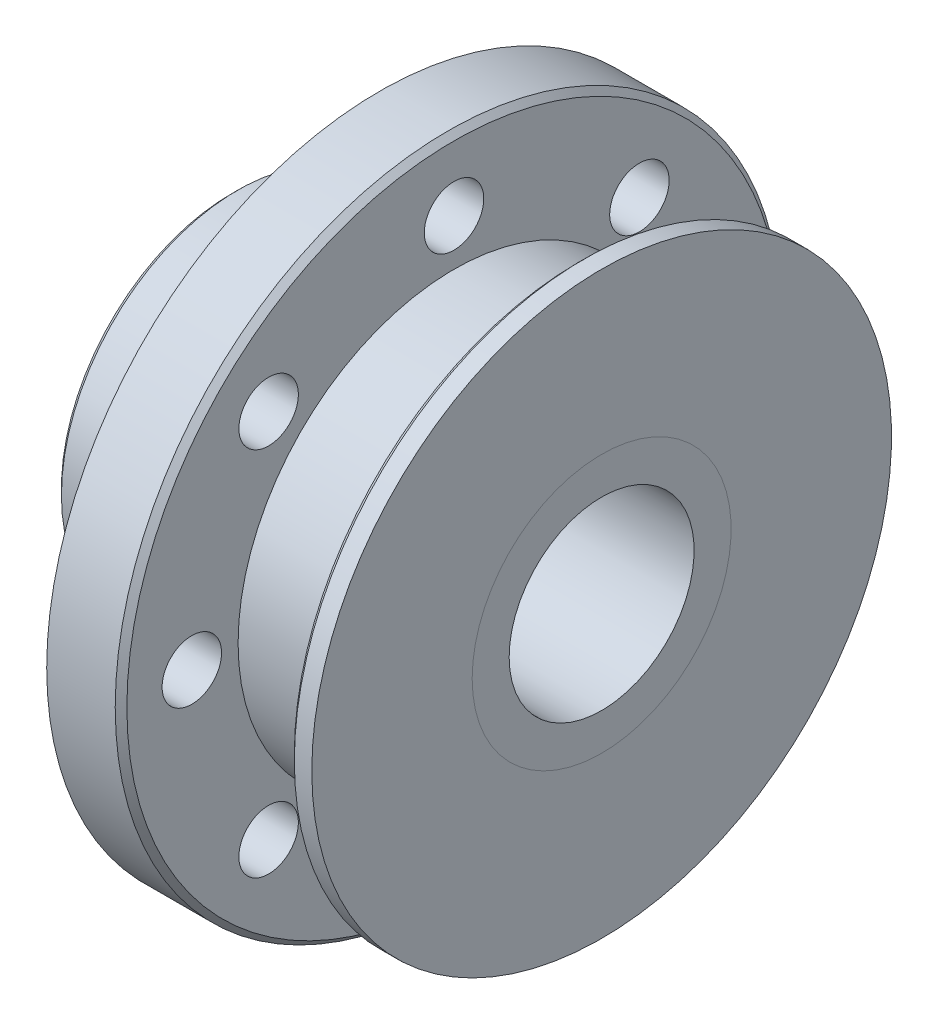
from build123d import *

# Parameters (mm, degrees)
F_1_4_20_TAPPED_HOLE1_D     = 5.1054
F_1_4_20_TAPPED_HOLE1_DEPTH = 10.16
F_1_4_20_TAPPED_HOLE1_TIP   = 1.533816902
SKETCH5_W                   = 12.7
SKETCH5_H                   = 3.175
CHAMFER1_SIZE               = 0.5


with BuildPart() as part:
    # Sketch1 → Revolve1 (revolve)
    with BuildSketch(Plane.XY):
        Polygon((-12.7, 15.112500017), (0, 15.112500017), (0, 28.575), (6.37999994, 28.575), (6.37999994, 24.875000034), (6.37999994, 18.52951598), (17.04999994, 18.52951598), (17.04999994, 24.875000034), (19.05, 24.875000034), (19.05, 11.1125), (6.35, 11.1125), (6.35, 8.9375), (0, 8.9375), (0, 11.1125), (-12.7, 11.1125), align=None)
    revolve(axis=Axis((0, 0, 0), (1, 0, 0)))

    # 1/4-20 Tapped Hole1
    with Locations(Plane.ZY):
        with Locations((-15.909902577, -15.909902577), (-22.5, 0), (-15.909902577, 15.909902577), (0, 22.5), (15.909902577, 15.909902577), (22.5, 0), (15.909902577, -15.909902577), (0, -22.5)):
            Hole(F_1_4_20_TAPPED_HOLE1_D / 2, depth=F_1_4_20_TAPPED_HOLE1_DEPTH)
            with Locations((0, 0, -(F_1_4_20_TAPPED_HOLE1_DEPTH + F_1_4_20_TAPPED_HOLE1_TIP / 2))):  # 118° drill point
                Cone(0, F_1_4_20_TAPPED_HOLE1_D / 2, F_1_4_20_TAPPED_HOLE1_TIP, mode=Mode.SUBTRACT)

    # Chamfer1
    chamfer1_edges = [part.edges().sort_by_distance(p)[0] for p in [
        (17.04999994, -24.875000034, 0),
        (6.37999994, -28.575, 0),
        (-12.7, -15.112500017, 0),
    ]]
    chamfer(chamfer1_edges, length=CHAMFER1_SIZE)


with BuildPart() as body_2:
    # Sketch5 → Revolve2 (revolve)
    with BuildSketch(Plane.XY):
        with Locations((12.7, 9.525)):
            Rectangle(SKETCH5_W, SKETCH5_H)
        with Locations((-6.35, 9.525)):
            Rectangle(SKETCH5_W, SKETCH5_H)
    revolve(axis=Axis((0, 0, 0), (1, 0, 0)))


solid = Compound([part.part, body_2.part])
